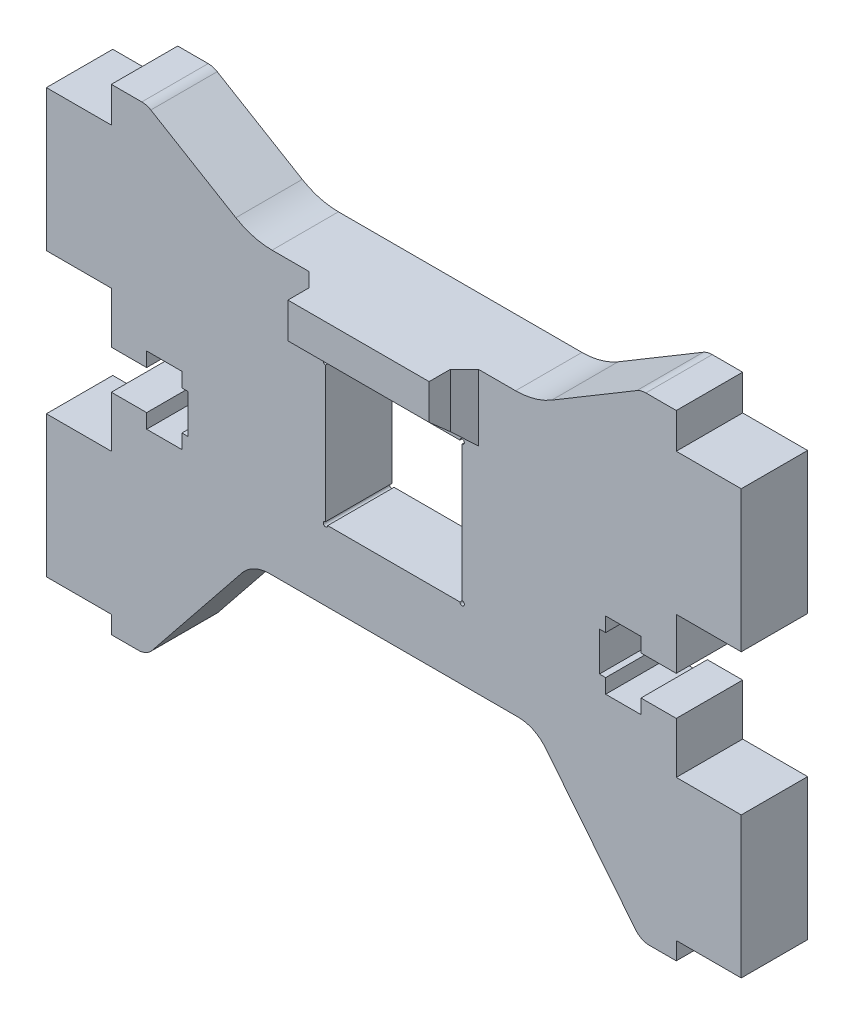
from build123d import *

# Parameters (mm, degrees)
SKETCH1_W           = 12.2904
SKETCH1_H           = 12.6
BOSS_EXTRUDE1_DEPTH = 5.969
CUT_EXTRUDE1_DEPTH  = 41.163946834
SKETCH3_R           = 0.1984375
CUT_EXTRUDE2_DEPTH  = 41.163946834
FILLET1_R           = 3.175
FILLET2_R           = 1.5875
FILLET9_R           = 6.35
SKETCH7_W           = 12.7
SKETCH7_H           = 3.175
BOSS_EXTRUDE2_DEPTH = 3.175
BOSS_EXTRUDE3_DEPTH = 3.175
CHAMFER1_SIZE       = 1.27


with BuildPart() as part:
    # Sketch1 → Boss-Extrude1 (new body)
    with BuildSketch(Plane.XY):
        Polygon((25.4, 2.463), (25.4, -10.237), (31.242, -10.237), (31.242, -22.937), (25.4, -22.937), (25.4, -24.5245), (22.225, -24.5245), (12.7, -12.65), (-12.7, -12.65), (-22.225, -24.5245), (-25.4, -24.5245), (-25.4, -22.937), (-31.242, -22.937), (-31.242, -10.237), (-25.4, -10.237), (-25.4, 2.463), (-31.242, 2.463), (-31.242, 15.163), (-25.4, 15.163), (-25.4, 18.338), (-22.225, 18.338), (-12.7, 12.65), (12.7, 12.65), (22.225, 18.338), (25.4, 18.338), (25.4, 15.163), (31.242, 15.163), (31.242, 2.463), align=None)
        Rectangle(SKETCH1_W, SKETCH1_H, mode=Mode.SUBTRACT)
    extrude(amount=BOSS_EXTRUDE1_DEPTH)

    # Sketch2 → Cut-Extrude1 (cut, through all)
    with BuildSketch(Plane.XY.offset(5.969)):
        Polygon((22.225, -2.1344), (22.225, -0.839), (19.05, -0.839), (19.05, -2.1344), (18.492, -2.1344), (18.492, -5.6396), (19.05, -5.6396), (19.05, -6.935), (22.225, -6.935), (22.225, -5.6396), (25.4, -5.6396), (25.4, -2.1344), align=None)
        Polygon((-19.05, -2.1344), (-19.05, -0.839), (-22.225, -0.839), (-22.225, -2.1344), (-25.4, -2.1344), (-25.4, -5.6396), (-22.225, -5.6396), (-22.225, -6.935), (-19.05, -6.935), (-19.05, -5.6396), (-18.492, -5.6396), (-18.492, -2.1344), align=None)
    extrude(amount=-CUT_EXTRUDE1_DEPTH, mode=Mode.SUBTRACT)

    # Sketch3 → Cut-Extrude2 (cut, through all)
    with BuildSketch(Plane.XY.offset(5.969)):
        with Locations((6.1452, 6.3)):
            Circle(SKETCH3_R)
        with Locations((-6.1452, 6.3)):
            Circle(SKETCH3_R)
        with Locations((-6.1452, -6.3)):
            Circle(SKETCH3_R)
        with Locations((6.1452, -6.3)):
            Circle(SKETCH3_R)
    extrude(amount=-CUT_EXTRUDE2_DEPTH, mode=Mode.SUBTRACT)

    # Fillet1
    fillet1_edges = [part.edges().sort_by_distance(p)[0] for p in [
        (-12.7, -12.65, 2.9845),
        (12.7, -12.65, 2.9845),
    ]]
    fillet(fillet1_edges, radius=FILLET1_R)

    # Fillet2
    fillet2_edges = [part.edges().sort_by_distance(p)[0] for p in [
        (22.225, -24.5245, 2.9845),
        (-22.225, -24.5245, 2.9845),
        (-22.225, 18.338, 2.9845),
        (22.225, 18.338, 2.9845),
    ]]
    fillet(fillet2_edges, radius=FILLET2_R)

    # Fillet9
    fillet9_edges = [part.edges().sort_by_distance(p)[0] for p in [
        (12.7, 12.65, 2.9845),
        (-12.7, 12.65, 2.9845),
    ]]
    fillet(fillet9_edges, radius=FILLET9_R)

    # Sketch7 → Boss-Extrude2 (add)
    with BuildSketch(Plane.XY.offset(5.969)):
        with Locations((0, 11.0625)):
            Rectangle(SKETCH7_W, SKETCH7_H)
    extrude(amount=BOSS_EXTRUDE2_DEPTH)

    # Sketch8 → Boss-Extrude3 (add)
    with BuildSketch(Plane.ZY.offset(6.35)):
        Polygon((5.969, 9.475), (5.969, 6.681), (9.144, 9.475), align=None)
    boss_extrude3 = extrude(amount=-BOSS_EXTRUDE3_DEPTH)

    # Mirror1: Boss-Extrude3 across plane
    add(boss_extrude3.mirror(Plane(origin=(0, 0, 0), x_dir=(0, 0, 1), z_dir=(1, 0, 0))))

    # Chamfer1
    chamfer1_edges = [part.edges().sort_by_distance(p)[0] for p in [
        (-6.35, 9.6655, 5.969),
        (6.35, 9.6655, 5.969),
    ]]
    chamfer(chamfer1_edges, length=CHAMFER1_SIZE)


solid = part.part
